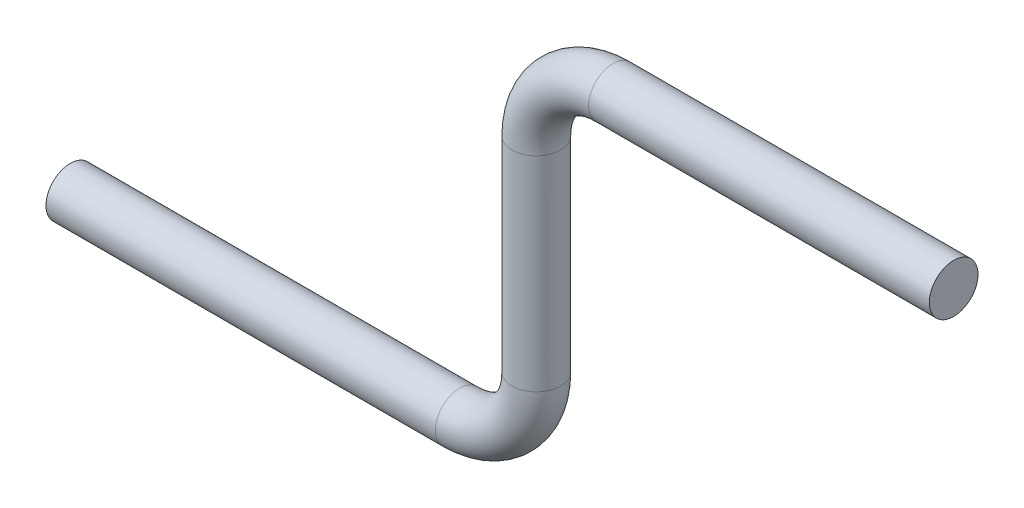
from build123d import *

# Parameters (mm, degrees)
SKETCH3_R = 2.5


with BuildPart() as part:
    # Sweep1: sweep along a path in Sketch1
    with BuildLine(Plane.XY) as sweep1_path:
        Line((-15.563195439, 0), (24.436804561, 0))
        ThreePointArc((24.436804561, 0), (30.004211849, 2.306095606), (32.310307454, 7.873502893))
        Line((32.310307454, 7.873502893), (32.310307454, 28.873502893))
        ThreePointArc((32.310307454, 28.873502893), (34.61640306, 34.44091018), (40.183810347, 36.747005786))
        Line((40.183810347, 36.747005786), (75.183810347, 36.747005786))
    # Sketch3 → Sweep1 (sweep)
    with BuildSketch(Plane(origin=(-15.563195439, 0, 0), x_dir=(0, 0, -1), z_dir=(1, 0, 0))):
        Circle(SKETCH3_R)
    sweep(path=sweep1_path.line)


solid = part.part
